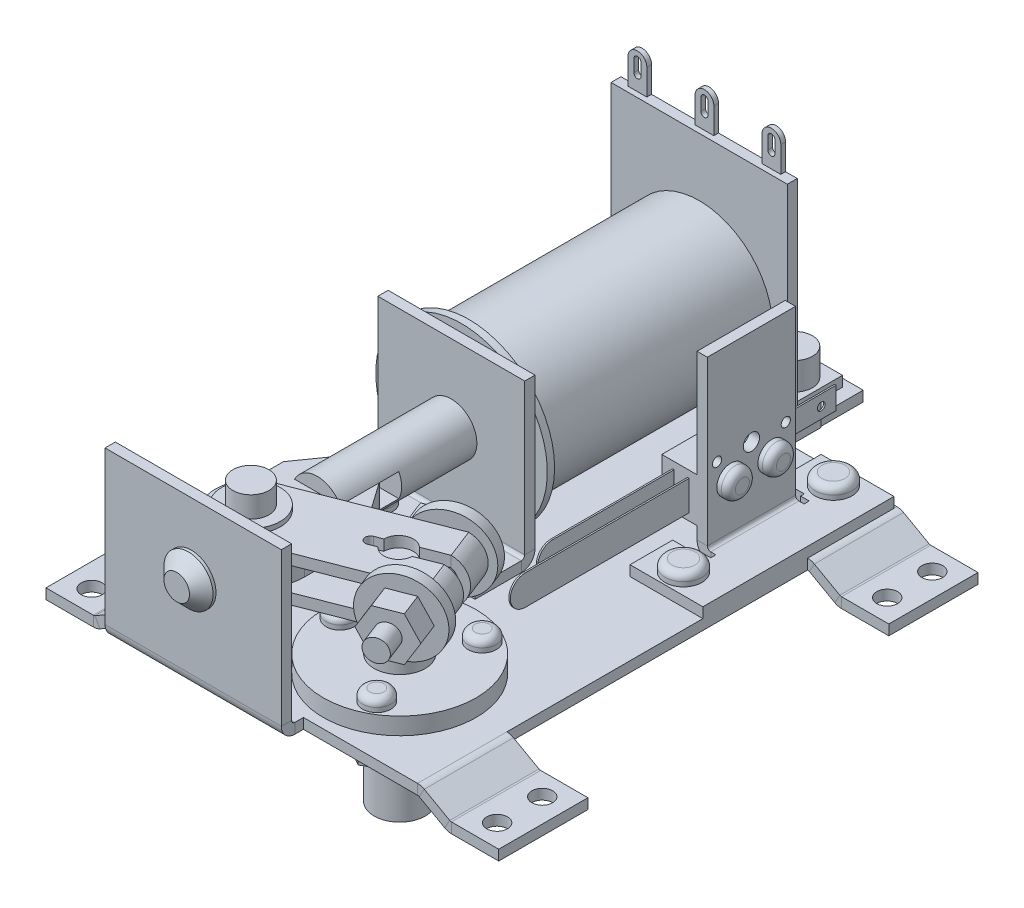
from build123d import *

# Parameters (mm, degrees)
BASE_FLANGE1_DEPTH            = 2.2225
MITER_START                   = -51.7906
MITER_FLANGE1_DEPTH           = 103.5812
MITER_FLANGE1_2_DEPTH         = 103.5812
SKETCH17_W                    = 17.536134357
SKETCH17_H                    = 65.024
SKETCH17_H_2                  = 18.161
CUT_EXTRUDE1_DEPTH            = 86.555963795
F_8_CLEARANCE_HOLE1_D         = 4.4958
SKETCH40_W                    = 38.1
SKETCH40_H                    = 4.7752
TAB2_DEPTH                    = 2.2225
EDGE_FLANGE1_STRIP_W          = 10.3632
EDGE_FLANGE1_STRIP_H          = 2.2225
EDGE_FLANGE1_STRIP_CUT_DEPTH  = 38.1
EDGE_FLANGE1_DEPTH            = 38.1
SKETCH21_W                    = 31.75
SKETCH21_H                    = 12.954
TAB1_DEPTH                    = 2.2225
EDGE_FLANGE3_STRIP_W          = 10.3632
EDGE_FLANGE3_STRIP_H          = 2.2225
EDGE_FLANGE3_STRIP_CUT_DEPTH  = 31.75
EDGE_FLANGE3_DEPTH            = 31.75
SKETCH20_W                    = 38.1
SKETCH20_H                    = 47.1297
BOSS_EXTRUDE1_DEPTH           = 2.1463
BOSS_EXTRUDE12_DEPTH          = 1.016
SKETCH31_R                    = 15.875
BOSS_EXTRUDE2_DEPTH           = 49.784
SKETCH32_R                    = 18.542
BOSS_EXTRUDE3_DEPTH           = 1.5748
SKETCH33_W                    = 31.75
SKETCH33_H                    = 12.954
BASE_FLANGE2_DEPTH            = 2.2225
EDGE_FLANGE4_STRIP_W          = 10.3632
EDGE_FLANGE4_STRIP_H          = 2.2225
EDGE_FLANGE4_STRIP_CUT_DEPTH  = 31.75
EDGE_FLANGE4_DEPTH            = 31.75
SKETCH47_R                    = 5.5372
BOSS_EXTRUDE4_DEPTH           = 28.956
SKETCH50_W                    = 12.7
SKETCH50_H                    = 5.08
CUT_EXTRUDE2_DEPTH            = 103.626816435
BOSS_EXTRUDE5_DEPTH           = 5.08
SKETCH52_R                    = 16.51
BOSS_EXTRUDE6_DEPTH           = 3.683
BOSS_EXTRUDE7_DEPTH           = 9.398
BOSS_EXTRUDE7_DEPTH_BACK      = 27.6225
SKETCH53_R                    = 5.5245
SKETCH54_R                    = 3.302
CUT_EXTRUDE3_DEPTH            = 95.987959439
BOSS_EXTRUDE8_DEPTH           = 8.001
CUT_EXTRUDE4_REACH            = 99.673
CUT_EXTRUDE5_DEPTH            = 2.3241
CUT_EXTRUDE6_DEPTH            = 2.3241
SKETCH85_R                    = 6.35
BOSS_EXTRUDE19_DEPTH          = 1.016
SKETCH86_R                    = 3.8989
BOSS_EXTRUDE20_DEPTH          = 4.572
BOSS_EXTRUDE9_DEPTH           = 2.3241
BOSS_EXTRUDE10_DEPTH          = 8.89
BOSS_EXTRUDE21_DEPTH          = 2.54
BOSS_EXTRUDE22_START          = 2.54
SKETCH88_R                    = 7.96925
BOSS_EXTRUDE22_DEPTH          = 2.54
BOSS_EXTRUDE23_DEPTH          = 5.08
SKETCH90_R                    = 2.3749
BOSS_EXTRUDE24_DEPTH          = 28.067
BASE_FLANGE3_DEPTH            = 2.2225
EDGE_FLANGE5_STRIP_W          = 10.3632
EDGE_FLANGE5_STRIP_H          = 2.2225
EDGE_FLANGE5_STRIP_CUT_DEPTH  = 19.05
EDGE_FLANGE5_RELIEF_W         = 11.47445
EDGE_FLANGE5_RELIEF_H         = 1.11125
EDGE_FLANGE5_RELIEF_CUT_DEPTH = 2.2225
EDGE_FLANGE5_DEPTH            = 19.05
SKETCH96_R                    = 1.7526
SKETCH96_R_2                  = 0.9906
CUT_EXTRUDE8_DEPTH            = 2.2225
SKETCH74_W                    = 19.05
SKETCH74_H                    = 9.525
BOSS_EXTRUDE11_DEPTH          = 7.62
BOSS_EXTRUDE13_DEPTH          = 0.3302
BOSS_EXTRUDE14_DEPTH          = 0.3302
SKETCH82_W                    = 12.7
SKETCH82_H                    = 4.7625
BOSS_EXTRUDE17_DEPTH          = 0.3302
SKETCH83_W                    = 12.7
SKETCH83_H                    = 4.7625
BOSS_EXTRUDE18_DEPTH          = 0.3302
CUT_EXTRUDE7_REACH            = 113.889
SKETCH84_R                    = 0.8382
SKETCH80_R                    = 5.3086
BOSS_EXTRUDE15_DEPTH          = 3.175
SKETCH81_R                    = 7.9375
BOSS_EXTRUDE16_DEPTH          = 3.048
SKETCH91_R                    = 3.8481
BOSS_EXTRUDE25_DEPTH          = 5.9055
SKETCH92_R                    = 4.0005
BOSS_EXTRUDE26_DEPTH          = 2.5019
SKETCH93_R                    = 3.048
BOSS_EXTRUDE27_DEPTH          = 2.4892
SKETCH94_R                    = 3.048
BOSS_EXTRUDE28_DEPTH          = 2.4892
SKETCH95_R                    = 3.048
BOSS_EXTRUDE29_DEPTH          = 2.4892
BOSS_EXTRUDE30_DEPTH          = 4.4069
SKETCH98_R                    = 4.318
BOSS_EXTRUDE31_DEPTH          = 3.175
CHAMFER1_SIZE                 = 2.54
FILLET1_R                     = 2.54
FILLET2_R                     = 1.524


# Read off the part's stored shape, not the designer's step: Miter Flange1
# Sheet-metal steps are written as plain solids
with BuildPart() as part:
    # Sketch1 → Base-Flange1 (new body)
    with BuildSketch(Plane(origin=(0, 0, 0), x_dir=(1, 0, 0), z_dir=(0, 1, 0))):
        Polygon((-32.1564, 51.7906), (-32.1564, 69.9516), (5.9436, 69.9516), (5.9436, 51.7906), (32.1564, 51.7906), (32.1564, -51.7906), (-32.1564, -51.7906), align=None)
    extrude(amount=BASE_FLANGE1_DEPTH)

    # Miter Flange1 outline → Miter Flange1 (cut)
    with BuildSketch(Plane.XY.offset(MITER_START)):
        with BuildLine():
            ThreePointArc((31.384265643, 2.2225), (31.773720604, 2.196759446), (32.1564, 2.119985609))
            Line((32.1564, 2.119985609), (32.1564, 2.2225))
            Line((32.1564, 2.2225), (31.384265643, 2.2225))
        make_face()
    miter_flange1 = extrude(amount=MITER_FLANGE1_DEPTH, mode=Mode.SUBTRACT)

    # Miter Flange1 2 outline → Miter Flange1 2 (add)
    with BuildSketch(Plane.XY.offset(MITER_START)):
        with BuildLine():
            Line((38.698605119, -3.556), (48.9204, -3.556))
            Line((48.9204, -3.556), (48.9204, -1.3335))
            Line((48.9204, -1.3335), (38.698605119, -1.3335))
            ThreePointArc((38.698605119, -1.3335), (38.512627123, -1.309635396), (38.338699877, -1.239587931))
            Line((38.338699877, -1.239587931), (32.830091872, 1.845232552))
            ThreePointArc((32.830091872, 1.845232552), (32.501722399, 2.003393286), (32.1564, 2.119985609))
            Line((32.1564, 2.119985609), (32.1564, 0))
            Line((32.1564, 0), (31.384265643, 0))
            ThreePointArc((31.384265643, 0), (31.570243638, -0.023864604), (31.744170884, -0.093912069))
            Line((31.744170884, -0.093912069), (37.25277889, -3.178732552))
            ThreePointArc((37.25277889, -3.178732552), (37.951486619, -3.460130126), (38.698605119, -3.556))
        make_face()
    miter_flange1_2 = extrude(amount=MITER_FLANGE1_2_DEPTH)

    # Sketch17 → Cut-Extrude1 (cut, through all)
    with BuildSketch(Plane(origin=(0, 2.2225, 0), x_dir=(1, 0, 0), z_dir=(0, 1, 0))):
        with Locations((40.152332822, 0)):
            Rectangle(SKETCH17_W, SKETCH17_H)
        with Locations((40.152332822, 60.8711)):
            Rectangle(SKETCH17_W, SKETCH17_H_2)
    cut_extrude1 = extrude(amount=-CUT_EXTRUDE1_DEPTH, mode=Mode.SUBTRACT)

    # #8 Clearance Hole1 (through all)
    with Locations(Plane(origin=(0, -1.3335, 0), x_dir=(1, 0, 0), z_dir=(0, 1, 0))):
        with Locations((43.809502559, 47.0281), (43.809502559, 37.2745), (43.809502559, -37.2745), (43.809502559, -47.0281)):
            f_8_clearance_hole1 = Hole(F_8_CLEARANCE_HOLE1_D / 2)

    # Mirror2: Miter Flange1, Miter Flange1 2, Cut-Extrude1, #8 Clearance Hole1 across plane
    add(miter_flange1.mirror(Plane(origin=(0, 0, 0), x_dir=(0, 0, 1), z_dir=(1, 0, 0))), mode=Mode.SUBTRACT)
    add(miter_flange1_2.mirror(Plane(origin=(0, 0, 0), x_dir=(0, 0, 1), z_dir=(1, 0, 0))))
    add(cut_extrude1.mirror(Plane(origin=(0, 0, 0), x_dir=(0, 0, 1), z_dir=(1, 0, 0))), mode=Mode.SUBTRACT)
    add(f_8_clearance_hole1.mirror(Plane(origin=(0, 0, 0), x_dir=(0, 0, 1), z_dir=(1, 0, 0))), mode=Mode.SUBTRACT)

    # Sketch40 → Tab2 (add)
    with BuildSketch(Plane(origin=(0, 2.2225, 0), x_dir=(1, 0, 0), z_dir=(0, 1, 0))):
        with Locations((-12.334265643, -54.1782)):
            Rectangle(SKETCH40_W, SKETCH40_H)
    extrude(amount=-TAB2_DEPTH)

    # Edge-Flange1 strip (across the edge) → Edge-Flange1 strip cut (cut)
    with BuildSketch(Plane(origin=(-31.384265643, 2.2225, 56.5658), x_dir=(0, 0, -1), z_dir=(1, 0, 0))):
        with Locations((-2.2225, -1.11125)):
            Rectangle(EDGE_FLANGE1_STRIP_W, EDGE_FLANGE1_STRIP_H)
    extrude(amount=EDGE_FLANGE1_STRIP_CUT_DEPTH, mode=Mode.SUBTRACT)

    # Edge-Flange1 section (across the edge) → Edge-Flange1 (add)
    with BuildSketch(Plane(origin=(-31.384265643, 2.2225, 56.5658), x_dir=(0, 0, -1), z_dir=(1, 0, 0))):
        with BuildLine():
            Line((0, 0.7366), (0, 33.782))
            Line((0, 33.782), (2.2225, 33.782))
            Line((2.2225, 33.782), (2.2225, 0.7366))
            ThreePointArc((2.2225, 0.7366), (2.438245145, 0.215745145), (2.9591, 0))
            Line((2.9591, 0), (2.9591, -2.2225))
            ThreePointArc((2.9591, -2.2225), (0.866700324, -1.355799676), (0, 0.7366))
        make_face()
    extrude(amount=EDGE_FLANGE1_DEPTH)



with BuildPart() as body_2:
    # Sketch21 → Tab1 (new body)
    with BuildSketch(Plane(origin=(0, 2.2225, 0), x_dir=(1, 0, 0), z_dir=(0, 1, 0))):
        with Locations((-12.720332821, 61.7982)):
            Rectangle(SKETCH21_W, SKETCH21_H)
    extrude(amount=TAB1_DEPTH)

    # Edge-Flange3 strip (across the edge) → Edge-Flange3 strip cut (cut)
    with BuildSketch(Plane(origin=(-28.595332821, 4.445, -55.3212), x_dir=(0, 0, -1), z_dir=(1, 0, 0))):
        with Locations((-2.2225, -1.11125)):
            Rectangle(EDGE_FLANGE3_STRIP_W, EDGE_FLANGE3_STRIP_H)
    extrude(amount=EDGE_FLANGE3_STRIP_CUT_DEPTH, mode=Mode.SUBTRACT)

    # Edge-Flange3 section (across the edge) → Edge-Flange3 (add)
    with BuildSketch(Plane(origin=(-28.595332821, 4.445, -55.3212), x_dir=(0, 0, -1), z_dir=(1, 0, 0))):
        with BuildLine():
            Line((0, 0.7366), (0, 33.4264))
            Line((0, 33.4264), (2.2225, 33.4264))
            Line((2.2225, 33.4264), (2.2225, 0.7366))
            ThreePointArc((2.2225, 0.7366), (2.438245145, 0.215745145), (2.9591, 0))
            Line((2.9591, 0), (2.9591, -2.2225))
            ThreePointArc((2.9591, -2.2225), (0.866700324, -1.355799676), (0, 0.7366))
        make_face()
    extrude(amount=EDGE_FLANGE3_DEPTH)


with BuildPart() as part_1:
    add(part.part)

    add(body_2.part)  # Boss-Extrude1 merges body 2
    # Sketch20 → Boss-Extrude1 (add)
    with BuildSketch(Plane(origin=(0, 0, -55.3212), x_dir=(-1, 0, 0), z_dir=(0, 0, -1))):
        with Locations((12.720332821, 25.78735)):
            Rectangle(SKETCH20_W, SKETCH20_H)
    extrude(amount=-BOSS_EXTRUDE1_DEPTH)

    # Sketch77 → Boss-Extrude12 (add)
    # profile 1 of 3: a face of its own
    with BuildSketch(Plane(origin=(0, 0, -55.3212), x_dir=(-1, 0, 0), z_dir=(0, 0, -1))):
        with BuildLine():
            Line((29.230332821, 49.3522), (25.166332821, 49.3522))
            Line((25.166332821, 49.3522), (25.166332821, 54.9402))
            ThreePointArc((25.166332821, 54.9402), (27.198332821, 56.9722), (29.230332821, 54.9402))
            Line((29.230332821, 54.9402), (29.230332821, 49.3522))
        make_face()
        with BuildLine():
            Line((27.960332821, 55.1942), (27.960332821, 52.5272))
            ThreePointArc((27.960332821, 52.5272), (27.198332821, 51.7652), (26.436332821, 52.5272))
            Line((26.436332821, 52.5272), (26.436332821, 55.1942))
            ThreePointArc((26.436332821, 55.1942), (27.198332821, 55.9562), (27.960332821, 55.1942))
        make_face(mode=Mode.SUBTRACT)
    # profile 2 of 3: a face of its own
    with BuildSketch(Plane(origin=(0, 0, -55.3212), x_dir=(-1, 0, 0), z_dir=(0, 0, -1))):
        with BuildLine():
            Line((14.752332821, 49.3522), (10.688332821, 49.3522))
            Line((10.688332821, 49.3522), (10.688332821, 54.9402))
            ThreePointArc((10.688332821, 54.9402), (12.720332821, 56.9722), (14.752332821, 54.9402))
            Line((14.752332821, 54.9402), (14.752332821, 49.3522))
        make_face()
        with BuildLine():
            Line((13.482332821, 55.1942), (13.482332821, 52.5272))
            ThreePointArc((13.482332821, 52.5272), (12.720332821, 51.7652), (11.958332821, 52.5272))
            Line((11.958332821, 52.5272), (11.958332821, 55.1942))
            ThreePointArc((11.958332821, 55.1942), (12.720332821, 55.9562), (13.482332821, 55.1942))
        make_face(mode=Mode.SUBTRACT)
    # profile 3 of 3: a face of its own
    with BuildSketch(Plane(origin=(0, 0, -55.3212), x_dir=(-1, 0, 0), z_dir=(0, 0, -1))):
        with BuildLine():
            Line((0.274332821, 49.3522), (0.274332821, 54.9402))
            ThreePointArc((0.274332821, 54.9402), (-1.757667179, 56.9722), (-3.789667179, 54.9402))
            Line((-3.789667179, 54.9402), (-3.789667179, 49.3522))
            Line((-3.789667179, 49.3522), (0.274332821, 49.3522))
        make_face()
        with BuildLine():
            Line((-0.995667179, 55.1942), (-0.995667179, 52.5272))
            ThreePointArc((-0.995667179, 52.5272), (-1.757667179, 51.7652), (-2.519667179, 52.5272))
            Line((-2.519667179, 52.5272), (-2.519667179, 55.1942))
            ThreePointArc((-2.519667179, 55.1942), (-1.757667179, 55.9562), (-0.995667179, 55.1942))
        make_face(mode=Mode.SUBTRACT)
    extrude(amount=-BOSS_EXTRUDE12_DEPTH)

    # Sketch31 → Boss-Extrude2 (add)
    with BuildSketch(Plane.XY.offset(-53.1749)):
        with Locations(Location((-12.720332821, 20.8915, 0), (0, 0, 180))):
            Circle(SKETCH31_R)
    extrude(amount=BOSS_EXTRUDE2_DEPTH)

    # Sketch32 → Boss-Extrude3 (add)
    with BuildSketch(Plane.XY.offset(-3.3909)):
        with Locations((-12.720332821, 20.8915)):
            Circle(SKETCH32_R)
    extrude(amount=BOSS_EXTRUDE3_DEPTH)



with BuildPart() as body_2_2:
    # Sketch33 → Base-Flange2 (new body)
    with BuildSketch(Plane(origin=(0, 2.2225, 0), x_dir=(1, 0, 0), z_dir=(0, 1, 0))):
        with Locations((-12.720332821, -4.6609)):
            Rectangle(SKETCH33_W, SKETCH33_H)
    extrude(amount=BASE_FLANGE2_DEPTH)

    # Edge-Flange4 strip (across the edge) → Edge-Flange4 strip cut (cut)
    with BuildSketch(Plane(origin=(3.154667179, 4.445, -1.8161), x_dir=(0, 0, 1), z_dir=(-1, 0, 0))):
        with Locations((-2.2225, -1.11125)):
            Rectangle(EDGE_FLANGE4_STRIP_W, EDGE_FLANGE4_STRIP_H)
    extrude(amount=EDGE_FLANGE4_STRIP_CUT_DEPTH, mode=Mode.SUBTRACT)

    # Edge-Flange4 section (across the edge) → Edge-Flange4 (add)
    with BuildSketch(Plane(origin=(3.154667179, 4.445, -1.8161), x_dir=(0, 0, 1), z_dir=(-1, 0, 0))):
        with BuildLine():
            Line((0, 0.7366), (0, 33.274))
            Line((0, 33.274), (2.2225, 33.274))
            Line((2.2225, 33.274), (2.2225, 0.7366))
            ThreePointArc((2.2225, 0.7366), (2.438245145, 0.215745145), (2.9591, 0))
            Line((2.9591, 0), (2.9591, -2.2225))
            ThreePointArc((2.9591, -2.2225), (0.866700324, -1.355799676), (0, 0.7366))
        make_face()
    extrude(amount=EDGE_FLANGE4_DEPTH)


with BuildPart() as part_2:
    add(part_1.part)

    add(body_2_2.part)  # Boss-Extrude4 merges body 2 2
    # Sketch47 → Boss-Extrude4 (add)
    with BuildSketch(Plane.XY.offset(0.4064)):
        with Locations((-12.720332821, 20.8915)):
            Circle(SKETCH47_R)
    extrude(amount=BOSS_EXTRUDE4_DEPTH)

    # Sketch50 → Cut-Extrude2 (cut, through all)
    with BuildSketch(Plane(origin=(0, 0, 0), x_dir=(0, 0, -1), z_dir=(1, 0, 0))):
        with Locations((-23.0124, 20.8915)):
            Rectangle(SKETCH50_W, SKETCH50_H)
    extrude(amount=-CUT_EXTRUDE2_DEPTH, mode=Mode.SUBTRACT)

    # Sketch51 → Boss-Extrude5 (add)
    with BuildSketch(Plane(origin=(0, 18.3515, 0), x_dir=(1, 0, 0), z_dir=(0, 1, 0))):
        with BuildLine():
            Line((-3.322332821, -27.2796), (-3.322332821, -41.5544))
            ThreePointArc((-3.322332821, -41.5544), (-12.720332821, -50.9524), (-22.118332821, -41.5544))
            Line((-22.118332821, -41.5544), (-22.118332821, -27.2796))
            Line((-22.118332821, -27.2796), (-17.6405954, -20.928201858))
            ThreePointArc((-17.6405954, -20.928201858), (-12.720332821, -18.3769), (-7.800070243, -20.928201858))
            Line((-7.800070243, -20.928201858), (-3.322332821, -27.2796))
        make_face()
    extrude(amount=BOSS_EXTRUDE5_DEPTH)

    # Sketch52 → Boss-Extrude6 (add)
    with BuildSketch(Plane(origin=(0, 2.2225, 0), x_dir=(1, 0, 0), z_dir=(0, 1, 0))):
        with Locations(Location((8.879865643, -33.147, 0), (0, 0, 90))):
            Circle(SKETCH52_R)
    extrude(amount=BOSS_EXTRUDE6_DEPTH)

    # Sketch53 → Boss-Extrude7 (add, two sides: drawn at the far end of the back side and taken through both)
    with BuildSketch(Plane(origin=(0, 5.9055, 0), x_dir=(1, 0, 0), z_dir=(0, 1, 0)).offset(-BOSS_EXTRUDE7_DEPTH_BACK)):
        with Locations(Location((8.879865643, -33.147, 0), (0, 0, 270))):
            Circle(SKETCH53_R)
    extrude(amount=BOSS_EXTRUDE7_DEPTH + BOSS_EXTRUDE7_DEPTH_BACK)

    # Sketch54 → Cut-Extrude3 (cut, through all)
    with BuildSketch(Plane(origin=(0, 15.3035, 0), x_dir=(1, 0, 0), z_dir=(0, 1, 0))):
        with Locations(Location((8.879865643, -33.147, 0), (0, 0, 270))):
            Circle(SKETCH54_R)
    extrude(amount=-CUT_EXTRUDE3_DEPTH, mode=Mode.SUBTRACT)

    # Sketch56 → Boss-Extrude8 (add, symmetric)
    with BuildSketch(Plane(origin=(12.372594649, 0, 31.787532405), x_dir=(0.9318979099545631, 0, -0.36272067134686037), z_dir=(0.36272067134686037, 0, 0.9318979099545631))):
        with BuildLine():
            Line((-36.324691436, 23.4315), (4.25302614, 23.4315))
            ThreePointArc((4.25302614, 23.4315), (5.480987553, 20.8915), (4.25302614, 18.3515))
            Line((4.25302614, 18.3515), (-36.324691436, 18.3515))
            Line((-36.324691436, 18.3515), (-36.324691436, 16.0274))
            Line((-36.324691436, 16.0274), (4.25302614, 16.0274))
            ThreePointArc((4.25302614, 16.0274), (7.50422614, 20.8915), (4.25302614, 25.7556))
            Line((4.25302614, 25.7556), (-36.324691436, 25.7556))
            Line((-36.324691436, 25.7556), (-36.324691436, 23.4315))
        make_face()
    extrude(amount=BOSS_EXTRUDE8_DEPTH, both=True)

    # Cut-Extrude4: up to this face of the body (flat: up to its plane)
    cut_extrude4_end = Plane(part_2.part.faces().sort_by_distance((-2.571164279, 16.0274, 37.604060389))[0])
    # Sketch57 → Cut-Extrude4 (cut, up to the picked face)
    with BuildSketch(Plane(origin=(0, 25.7556, 0), x_dir=(1, 0, 0), z_dir=(0, 1, 0)), mode=Mode.PRIVATE) as cut_extrude4_sk1:
        with BuildLine():
            Line((18.88207929, -27.822908599), (19.84945532, -30.308280325))
            Line((19.84945532, -30.308280325), (11.883022626, -33.409038234))
            ThreePointArc((11.883022626, -33.409038234), (9.773163163, -36.204678559), (6.374620107, -35.357910071))
            Line((6.374620107, -35.357910071), (4.760958728, -35.985992109))
            ThreePointArc((4.760958728, -35.985992109), (3.270026604, -35.330505897), (3.925512816, -33.839573773))
            Line((3.925512816, -33.839573773), (5.539174194, -33.211491735))
            ThreePointArc((5.539174194, -33.211491735), (7.471002821, -30.289993843), (10.915646595, -30.923666509))
            Line((10.915646595, -30.923666509), (18.88207929, -27.822908599))
        make_face()
    cut_extrude4_tool1 = split(extrude(cut_extrude4_sk1.sketch, amount=-CUT_EXTRUDE4_REACH, mode=Mode.PRIVATE), bisect_by=cut_extrude4_end, keep=Keep.BOTH, mode=Mode.PRIVATE)
    add(cut_extrude4_tool1.solids().sort_by(Axis((10.846251, 25.7556, 32.381628), (0, -1, 0)))[0], mode=Mode.SUBTRACT)

    # Sketch58 → Cut-Extrude5 (cut)
    with BuildSketch(Plane(origin=(0, 25.7556, 0), x_dir=(1, 0, 0), z_dir=(0, 1, 0))):
        with BuildLine():
            ThreePointArc((-21.478309466, -44.963248645), (-21.34657821, -38.840965518), (-16.924322293, -34.6050056))
            Line((-16.924322293, -34.6050056), (-24.380437471, -37.507133692))
            Line((-24.380437471, -37.507133692), (-21.478309466, -44.963248645))
        make_face()
        with BuildLine():
            ThreePointArc((-11.12006611, -49.517235955), (-17.242349462, -49.385504786), (-21.478309466, -44.963248645))
            Line((-21.478309466, -44.963248645), (-18.576181288, -52.419364047))
            Line((-18.576181288, -52.419364047), (-11.12006611, -49.517235955))
        make_face()
    extrude(amount=-CUT_EXTRUDE5_DEPTH, mode=Mode.SUBTRACT)

    # Sketch61 → Cut-Extrude6 (cut)
    with BuildSketch(Plane(origin=(0, 18.3515, 0), x_dir=(1, 0, 0), z_dir=(0, 1, 0))):
        with BuildLine():
            ThreePointArc((-22.118332821, -41.5544), (-21.956941173, -43.288605915), (-21.478309379, -44.963248869))
            ThreePointArc((-21.478309379, -44.963248869), (-21.346578258, -38.840965628), (-16.924322293, -34.6050056))
            Line((-16.924322293, -34.6050056), (-22.118332821, -36.626659438))
            Line((-22.118332821, -36.626659438), (-22.118332821, -41.5544))
        make_face()
        with BuildLine():
            Line((-21.478309379, -44.963248869), (-18.576181288, -52.419364047))
            Line((-18.576181288, -52.419364047), (-11.12006611, -49.517235955))
            ThreePointArc((-11.12006611, -49.517235955), (-17.242349352, -49.385504835), (-21.478309379, -44.963248869))
        make_face()
        with BuildLine():
            Line((-24.380437471, -37.507133692), (-21.478309379, -44.963248869))
            ThreePointArc((-21.478309379, -44.963248869), (-21.956941173, -43.288605915), (-22.118332821, -41.5544))
            Line((-22.118332821, -41.5544), (-22.118332821, -36.626659438))
            Line((-22.118332821, -36.626659438), (-24.380437471, -37.507133692))
        make_face()
    extrude(amount=-CUT_EXTRUDE6_DEPTH, mode=Mode.SUBTRACT)

    # Sketch85 → Boss-Extrude19 (add)
    with BuildSketch(Plane(origin=(0, 25.7556, 0), x_dir=(1, 0, 0), z_dir=(0, 1, 0))):
        with Locations(Location((-14.270731374, -42.157858381, 0), (0, 0, 270))):
            Circle(SKETCH85_R)
    extrude(amount=BOSS_EXTRUDE19_DEPTH)

    # Sketch86 → Boss-Extrude20 (add)
    with BuildSketch(Plane(origin=(0, 26.7716, 0), x_dir=(1, 0, 0), z_dir=(0, 1, 0))):
        with Locations(Location((-14.270731374, -42.157858381, 0), (0, 0, 270))):
            Circle(SKETCH86_R)
    extrude(amount=BOSS_EXTRUDE20_DEPTH)

    # Sketch66 → Boss-Extrude9 (add)
    with BuildSketch(Plane(origin=(0, 18.3515, 0), x_dir=(1, 0, 0), z_dir=(0, 1, 0))):
        Polygon((0.320558099, -27.89281693), (7.895024311, -24.944623313), (2.919947583, -12.16271158), (-4.654518629, -15.110905197), align=None)
    extrude(amount=-BOSS_EXTRUDE9_DEPTH)

    # Sketch67 → Boss-Extrude10 (add)
    with BuildSketch(Plane.XZ.offset(-16.0274)):
        Polygon((2.919947583, 12.16271158), (-4.654518629, 15.110905197), (-3.848371937, 17.182048302), (3.726094275, 14.233854685), align=None)
    extrude(amount=BOSS_EXTRUDE10_DEPTH)

    # Sketch87 → Boss-Extrude21 (add)
    with BuildSketch(Plane(origin=(9.470466558, 0, 24.331417228), x_dir=(-0.9318979099545631, 0, 0.3627206713468604), z_dir=(-0.36272067134686037, 0, -0.931897909954563))):
        with BuildLine():
            Line((1.18257386, 13.269407754), (1.18257386, 18.9611))
            Line((1.18257386, 18.9611), (6.813605681, 20.4597))
            ThreePointArc((6.813605681, 20.4597), (-7.418132373, 25.805095926), (1.18257386, 13.269407754))
        make_face()
    extrude(amount=BOSS_EXTRUDE21_DEPTH)

    # Sketch88 → Boss-Extrude22 (add)
    with BuildSketch(Plane(origin=(15.274722741, 0, 39.243647583), x_dir=(0.9318979099545631, 0, -0.3627206713468604), z_dir=(0.36272067134686037, 0, 0.931897909954563)).offset(BOSS_EXTRUDE22_START)):
        with Locations(Location((1.143937553, 20.8915, 0), (0, 0, 161.414158173))):
            Circle(SKETCH88_R)
    extrude(amount=-BOSS_EXTRUDE22_DEPTH)

    # Sketch89 → Boss-Extrude23 (add)
    with BuildSketch(Plane(origin=(16.196033246, 0, 41.610668274), x_dir=(0.931897909954563, 0, -0.36272067134686053), z_dir=(0.36272067134686053, 0, 0.931897909954563))):
        Polygon((-1.605693104, 25.654), (-4.355323761, 20.8915), (-1.605693104, 16.129), (3.89356821, 16.129), (6.643198867, 20.8915), (3.89356821, 25.654), align=None)
    extrude(amount=BOSS_EXTRUDE23_DEPTH)

    # Sketch90 → Boss-Extrude24 (add)
    with BuildSketch(Plane(origin=(9.470466558, 0, 24.331417228), x_dir=(0.9318979099545631, 0, -0.36272067134686037), z_dir=(0.36272067134686037, 0, 0.9318979099545631))):
        with Locations((1.143937553, 20.8915)):
            Circle(SKETCH90_R)
    extrude(amount=BOSS_EXTRUDE24_DEPTH)



with BuildPart() as body_2_3:
    # Sketch68 → Base-Flange3 (new body)
    with BuildSketch(Plane(origin=(0, 2.2225, 0), x_dir=(1, 0, 0), z_dir=(0, 1, 0))):
        Polygon((31.384265643, 51.1683), (15.636265643, 51.1683), (15.636265643, 41.9481), (21.224265643, 41.9481), (21.224265643, 19.0881), (15.636265643, 19.0881), (15.636265643, 9.8679), (31.384265643, 9.8679), align=None)
    extrude(amount=BASE_FLANGE3_DEPTH)

    # Edge-Flange5 strip (across the edge) → Edge-Flange5 strip cut (cut)
    with BuildSketch(Plane(origin=(21.224265643, 4.445, -40.0431), x_dir=(1, 0, 0), z_dir=(0, 0, 1))):
        with Locations((-4.445, -1.11125)):
            Rectangle(EDGE_FLANGE5_STRIP_W, EDGE_FLANGE5_STRIP_H)
    extrude(amount=EDGE_FLANGE5_STRIP_CUT_DEPTH, mode=Mode.SUBTRACT)

    # Edge-Flange5 relief (on the sheet) → Edge-Flange5 relief cut (cut)
    with BuildSketch(Plane(origin=(21.960865643, 4.445, -40.0431), x_dir=(1, 0, 0), z_dir=(0, 1, 0))):
        with Locations((-4.625975, 0.555625)):
            Rectangle(EDGE_FLANGE5_RELIEF_W, EDGE_FLANGE5_RELIEF_H)
        with Locations((-4.625975, -19.605625)):
            Rectangle(EDGE_FLANGE5_RELIEF_W, EDGE_FLANGE5_RELIEF_H)
    extrude(amount=-EDGE_FLANGE5_RELIEF_CUT_DEPTH, mode=Mode.SUBTRACT)

    # Edge-Flange5 section (across the edge) → Edge-Flange5 (add)
    with BuildSketch(Plane(origin=(21.224265643, 4.445, -40.0431), x_dir=(1, 0, 0), z_dir=(0, 0, 1))):
        with BuildLine():
            Line((-2.2225, 0.7366), (-2.2225, 36.068))
            Line((-2.2225, 36.068), (0, 36.068))
            Line((0, 36.068), (0, 0.7366))
            ThreePointArc((0, 0.7366), (0.215745145, 0.215745145), (0.7366, 0))
            Line((0.7366, 0), (0.7366, -2.2225))
            ThreePointArc((0.7366, -2.2225), (-1.355799676, -1.355799676), (-2.2225, 0.7366))
        make_face()
    extrude(amount=EDGE_FLANGE5_DEPTH)

    # Sketch96 → Cut-Extrude8 (cut)
    with BuildSketch(Plane(origin=(21.224265643, 0, 0), x_dir=(0, 0, -1), z_dir=(1, 0, 0))):
        with Locations(Location((30.5181, 19.8755, 0), (0, 0, 90))):
            Circle(SKETCH96_R)
        with Locations(Location((37.9476, 19.8755, 0), (0, 0, 90))):
            Circle(SKETCH96_R_2)
        with Locations(Location((23.0886, 19.8755, 0), (0, 0, 90))):
            Circle(SKETCH96_R_2)
    extrude(amount=-CUT_EXTRUDE8_DEPTH, mode=Mode.SUBTRACT)


with BuildPart() as part_3:
    add(part_2.part)

    add(body_2_3.part)  # Boss-Extrude11 merges body 2 3
    # Sketch74 → Boss-Extrude11 (add)
    with BuildSketch(Plane.ZY.offset(-19.001765643)):
        with Locations((-30.5181, 12.6365)):
            Rectangle(SKETCH74_W, SKETCH74_H)
    extrude(amount=BOSS_EXTRUDE11_DEPTH)

    # Sketch78 → Boss-Extrude13 (add)
    with BuildSketch(Plane(origin=(17.261865643, 0, 0), x_dir=(0, 0, -1), z_dir=(1, 0, 0))):
        with BuildLine():
            Line((20.9931, 15.875), (-14.3764, 15.875))
            ThreePointArc((-14.3764, 15.875), (-17.6149, 12.6365), (-14.3764, 9.398))
            Line((-14.3764, 9.398), (20.9931, 9.398))
            Line((20.9931, 9.398), (20.9931, 15.875))
        make_face()
    extrude(amount=-BOSS_EXTRUDE13_DEPTH)

    # Sketch79 → Boss-Extrude14 (add)
    with BuildSketch(Plane(origin=(14.036065643, 0, 0), x_dir=(0, 0, -1), z_dir=(1, 0, 0))):
        with BuildLine():
            Line((20.9931, 15.875), (-5.2324, 15.875))
            ThreePointArc((-5.2324, 15.875), (-8.4709, 12.6365), (-5.2324, 9.398))
            Line((-5.2324, 9.398), (20.9931, 9.398))
            Line((20.9931, 9.398), (20.9931, 15.875))
        make_face()
    extrude(amount=-BOSS_EXTRUDE14_DEPTH)

    # Sketch82 → Boss-Extrude17 (add)
    with BuildSketch(Plane(origin=(17.261865643, 0, 0), x_dir=(0, 0, -1), z_dir=(1, 0, 0))):
        with Locations((46.3931, 15.01775)):
            Rectangle(SKETCH82_W, SKETCH82_H)
    extrude(amount=-BOSS_EXTRUDE17_DEPTH)

    # Sketch83 → Boss-Extrude18 (add)
    with BuildSketch(Plane(origin=(14.036065643, 0, 0), x_dir=(0, 0, -1), z_dir=(1, 0, 0))):
        with Locations((46.3931, 10.25525)):
            Rectangle(SKETCH83_W, SKETCH83_H)
    extrude(amount=-BOSS_EXTRUDE18_DEPTH)

    # Cut-Extrude7: up to this face of the body (flat: up to its plane)
    cut_extrude7_end = Plane(part_3.part.faces().sort_by_distance((13.705865643, 10.25525, -46.3931))[0])
    # Sketch84 → Cut-Extrude7 (cut, up to the picked face)
    with BuildSketch(Plane(origin=(17.261865643, 0, 0), x_dir=(0, 0, -1), z_dir=(1, 0, 0)), mode=Mode.PRIVATE) as cut_extrude7_sk1:
        with Locations(Location((49.5681, 15.01775, 0), (0, 0, 90))):
            Circle(SKETCH84_R)
    cut_extrude7_tool1 = split(extrude(cut_extrude7_sk1.sketch, amount=-CUT_EXTRUDE7_REACH, mode=Mode.PRIVATE), bisect_by=cut_extrude7_end, keep=Keep.BOTH, mode=Mode.PRIVATE)
    # Sketch84 → Cut-Extrude7 (cut, up to the picked face)
    with BuildSketch(Plane(origin=(17.261865643, 0, 0), x_dir=(0, 0, -1), z_dir=(1, 0, 0)), mode=Mode.PRIVATE) as cut_extrude7_sk2:
        with Locations(Location((49.5681, 10.25525, 0), (0, 0, 90))):
            Circle(SKETCH84_R)
    cut_extrude7_tool2 = split(extrude(cut_extrude7_sk2.sketch, amount=-CUT_EXTRUDE7_REACH, mode=Mode.PRIVATE), bisect_by=cut_extrude7_end, keep=Keep.BOTH, mode=Mode.PRIVATE)
    add(cut_extrude7_tool1.solids().sort_by(Axis((17.261866, 15.01775, -49.5681), (-1, 0, 0)))[0], mode=Mode.SUBTRACT)
    add(cut_extrude7_tool2.solids().sort_by(Axis((17.261866, 10.25525, -49.5681), (-1, 0, 0)))[0], mode=Mode.SUBTRACT)

    # Sketch80 → Boss-Extrude15 (add)
    with BuildSketch(Plane.XY.offset(56.5658)):
        with Locations(Location((-12.720332821, 20.8915, 0), (0, 0, 180))):
            Circle(SKETCH80_R)
    extrude(amount=BOSS_EXTRUDE15_DEPTH)

    # Sketch81 → Boss-Extrude16 (add)
    with BuildSketch(Plane(origin=(0, 0, 54.3433), x_dir=(-1, 0, 0), z_dir=(0, 0, -1))):
        with Locations(Location((12.720332821, 20.8915, 0), (0, 0, 180))):
            Circle(SKETCH81_R)
    extrude(amount=BOSS_EXTRUDE16_DEPTH)

    # Sketch91 → Boss-Extrude25 (add)
    with BuildSketch(Plane(origin=(0, 4.445, 0), x_dir=(1, 0, 0), z_dir=(0, 1, 0))):
        with Locations(Location((-1.607832821, 62.6872, 0), (0, 0, 270))):
            Circle(SKETCH91_R)
        with Locations(Location((-23.832832821, 62.6872, 0), (0, 0, 270))):
            Circle(SKETCH91_R)
    extrude(amount=BOSS_EXTRUDE25_DEPTH)

    # Sketch92 → Boss-Extrude26 (add)
    with BuildSketch(Plane(origin=(0, 4.445, 0), x_dir=(1, 0, 0), z_dir=(0, 1, 0))):
        with Locations(Location((22.748265643, 14.3129, 0), (0, 0, 90))):
            Circle(SKETCH92_R)
        with Locations(Location((22.748265643, 46.7233, 0), (0, 0, 90))):
            Circle(SKETCH92_R)
    extrude(amount=BOSS_EXTRUDE26_DEPTH)

    # Sketch93 → Boss-Extrude27 (add)
    with BuildSketch(Plane(origin=(21.224265643, 0, 0), x_dir=(0, 0, -1), z_dir=(1, 0, 0))):
        with Locations(Location((26.0731, 15.113, 0), (0, 0, 90))):
            Circle(SKETCH93_R)
        with Locations(Location((34.9631, 15.113, 0), (0, 0, 90))):
            Circle(SKETCH93_R)
    extrude(amount=BOSS_EXTRUDE27_DEPTH)

    # Sketch94 → Boss-Extrude28 (add)
    with BuildSketch(Plane(origin=(0, 4.445, 0), x_dir=(1, 0, 0), z_dir=(0, 1, 0))):
        with Locations(Location((-23.007332821, -5.8039, 0), (0, 0, 270))):
            Circle(SKETCH94_R)
        with Locations(Location((-2.433332821, -5.8039, 0), (0, 0, 270))):
            Circle(SKETCH94_R)
    extrude(amount=BOSS_EXTRUDE28_DEPTH)

    # Sketch95 → Boss-Extrude29 (add)
    with BuildSketch(Plane(origin=(0, 5.9055, 0), x_dir=(1, 0, 0), z_dir=(0, 1, 0))):
        with Locations(Location((15.509265643, -21.944037807, 0), (0, 0, 270))):
            Circle(SKETCH95_R)
        with Locations(Location((15.267215499, -44.489709908, 0), (0, 0, 270))):
            Circle(SKETCH95_R)
        with Locations(Location((-4.136884214, -33.007252284, 0), (0, 0, 270))):
            Circle(SKETCH95_R)
    extrude(amount=BOSS_EXTRUDE29_DEPTH)

    # Sketch97 → Boss-Extrude30 (add)
    with BuildSketch(Plane.XZ):
        Polygon((0.815365643, 35.438358881), (-3.153384357, 37.729717762), (-7.122134357, 35.438358881), (-7.122134357, 30.855641119), (-3.153384357, 28.564282238), (0.815365643, 30.855641119), align=None)
        Polygon((18.865240643, 45.859459071), (14.896490643, 48.150817952), (10.927740643, 45.859459071), (10.927740643, 41.276741309), (14.896490643, 38.985382428), (18.865240643, 41.276741309), align=None)
        Polygon((14.896490643, 18.143182048), (18.865240643, 20.434540929), (18.865240643, 25.017258691), (14.896490643, 27.308617572), (10.927740643, 25.017258691), (10.927740643, 20.434540929), align=None)
    extrude(amount=BOSS_EXTRUDE30_DEPTH)

    # Sketch98 → Boss-Extrude31 (add)
    with BuildSketch(Plane.XZ):
        with Locations(Location((-23.832832821, -62.6872, 0), (0, 0, 270))):
            Circle(SKETCH98_R)
        with Locations(Location((-1.607832821, -62.6872, 0), (0, 0, 270))):
            Circle(SKETCH98_R)
    extrude(amount=BOSS_EXTRUDE31_DEPTH)

    # Chamfer1
    chamfer1_edges = [part_3.edges().sort_by_distance(p)[0] for p in [
        (-7.411732821, 20.8915, 59.7408),
    ]]
    chamfer(chamfer1_edges, length=CHAMFER1_SIZE)

    # Fillet1
    fillet1_edges = [part_3.edges().sort_by_distance(p)[0] for p in [
        (-20.657832821, 20.8915, 51.2953),
    ]]
    fillet(fillet1_edges, radius=FILLET1_R)

    # Fillet2
    fillet2_edges = [part_3.edges().sort_by_distance(p)[0] for p in [
        (22.748265643, 6.9469, -10.3124),
        (22.748265643, 6.9469, -42.7228),
        (23.713465643, 12.065, -26.0731),
        (23.713465643, 12.065, -34.9631),
        (-23.007332821, 6.9342, 2.7559),
        (-2.433332821, 6.9342, 2.7559),
        (15.509265643, 8.3947, 18.896037807),
        (15.267215499, 8.3947, 41.441709908),
        (-4.136884214, 8.3947, 29.959252284),
    ]]
    fillet(fillet2_edges, radius=FILLET2_R)


solid = part_3.part
